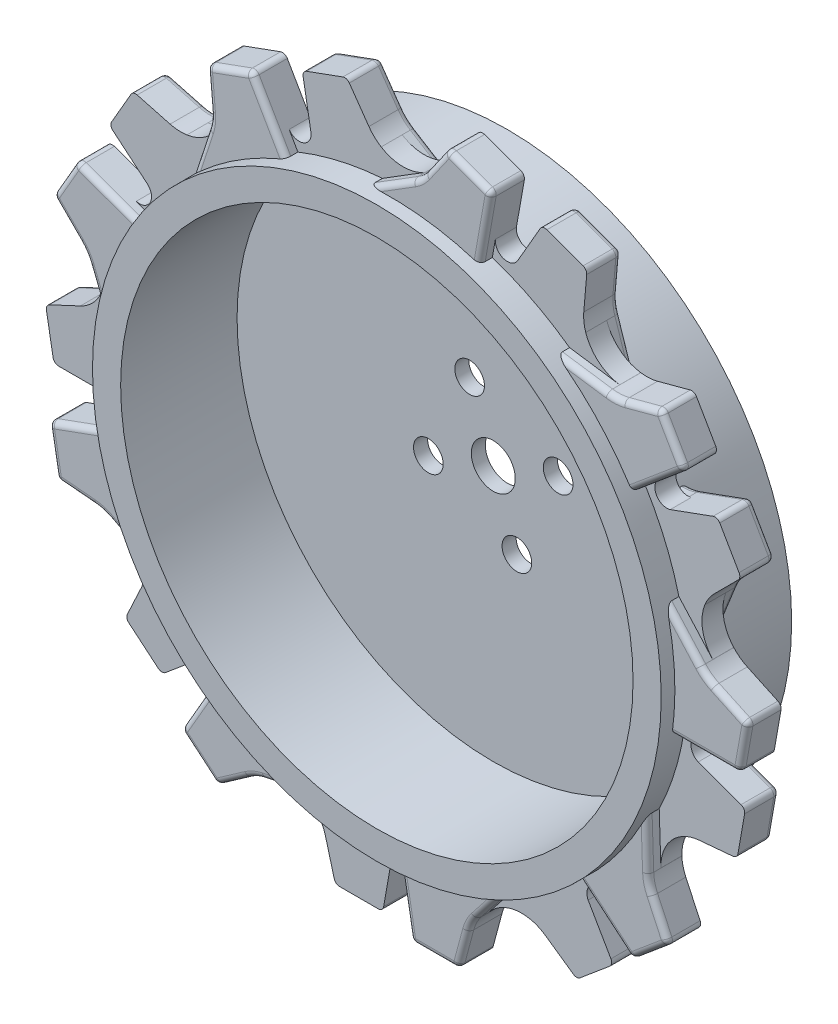
from build123d import *

# Parameters (mm, degrees)
BOSS_EXTRUDE3_DEPTH      = 3.9878
BOSS_EXTRUDE4_DEPTH      = 3.03
BOSS_EXTRUDE4_DEPTH_BACK = 11.96
SKETCH2_R                = 32.675
BOSS_EXTRUDE5_DEPTH      = 3.878
FILLET1_R                = 0.64
FILLET2_R                = 4.83
BOSS_EXTRUDE6_DEPTH      = 2.416
SKETCH5_R                = 29.439
CUT_EXTRUDE1_DEPTH       = 13.3772
SKETCH7_R                = 2.5265
SKETCH7_R_2              = 1.705
CUT_EXTRUDE2_DEPTH       = 1.6128


with BuildPart() as part:
    # Sketch1 → Boss-Extrude3 (new body)
    with BuildSketch(Plane.XY):
        with BuildLine():
            Line((2.40447012, 32.57804889), (-2.535542351, 35.644816652))
            ThreePointArc((-2.535542351, 35.644816652), (-3.305628506, 36.238022368), (-3.941337684, 36.973413113))
            Line((-3.941337684, 36.973413113), (-6.18856058, 40.174873341))
            ThreePointArc((-6.18856058, 40.174873341), (-6.520334289, 40.417679786), (-6.931364013, 40.408551267))
            Line((-6.931364013, 40.408551267), (-11.091948554, 38.893601767))
            ThreePointArc((-11.091948554, 38.893601767), (-11.427291277, 38.612125874), (-11.503227359, 38.180944785))
            Line((-11.503227359, 38.180944785), (-10.53546444, 32.7))
            ThreePointArc((-10.53546444, 32.7), (-10.462750974, 31.805424482), (-10.559003537, 30.913074747))
            ThreePointArc((-10.559003537, 30.913074747), (-14.992054318, 29.023250221), (-19.0988352, 26.501796921))
            Line((-19.0988352, 26.501796921), (-24.854384622, 25.675698515))
            ThreePointArc((-24.854384622, 25.675698515), (-25.825610126, 25.635118618), (-26.785291668, 25.789834629))
            Line((-26.785291668, 25.789834629), (-30.564623247, 26.797808414))
            ThreePointArc((-30.564623247, 26.797808414), (-30.974849628, 26.770548912), (-31.283848965, 26.499351247))
            Line((-31.283848965, 26.499351247), (-33.497250865, 22.664460409))
            ThreePointArc((-33.497250865, 22.664460409), (-33.573209078, 22.233283218), (-33.35422163, 21.854168568))
            Line((-33.35422163, 21.854168568), (-29.089788827, 18.277587286))
            ThreePointArc((-29.089788827, 18.277587286), (-28.459065022, 17.639041996), (-27.95920741, 16.893592486))
            ThreePointArc((-27.95920741, 16.893592486), (-30.140365536, 12.596392794), (-31.66558327, 8.025059638))
            Line((-31.66558327, 8.025059638), (-35.543584102, 3.692635689))
            ThreePointArc((-35.543584102, 3.692635689), (-36.261501748, 3.037257965), (-37.096109995, 2.538905901))
            Line((-37.096109995, 2.538905901), (-40.63915901, 0.881751105))
            ThreePointArc((-40.63915901, 0.881751105), (-40.935888579, 0.59718068), (-40.998273306, 0.190810271))
            Line((-40.998273306, 0.190810271), (-40.228817216, -4.169633862))
            ThreePointArc((-40.228817216, -4.169633862), (-40.009849227, -4.548759752), (-39.59840491, -4.698416004))
            Line((-39.59840491, -4.698416004), (-34.032677724, -4.697111652))
            ThreePointArc((-34.032677724, -4.697111652), (-33.139066258, -4.780844276), (-32.276987403, -5.030589452))
            ThreePointArc((-32.276987403, -5.030589452), (-31.185664747, -9.724456815), (-29.415653004, -14.206692238))
            Line((-29.415653004, -14.206692238), (-29.601545558, -20.018252415))
            ThreePointArc((-29.601545558, -20.018252415), (-29.7302337, -20.981769446), (-30.049246178, -21.900005116))
            Line((-30.049246178, -21.900005116), (-31.698180617, -25.446887345))
            ThreePointArc((-31.698180617, -25.446887345), (-31.742570312, -25.855615028), (-31.529149921, -26.207012952))
            Line((-31.529149921, -26.207012952), (-28.136872898, -29.052710109))
            ThreePointArc((-28.136872898, -29.052710109), (-27.725436263, -29.20238748), (-27.314054445, -29.052559511))
            Line((-27.314054445, -29.052559511), (-23.051298484, -25.473979846))
            ThreePointArc((-23.051298484, -25.473979846), (-22.312930093, -24.963720378), (-21.492006272, -24.600902676))
            ThreePointArc((-21.492006272, -24.600902676), (-17.638844833, -27.495125004), (-13.401811779, -29.790974926))
            Line((-13.401811779, -29.790974926), (-9.808614863, -34.362377736))
            ThreePointArc((-9.808614863, -34.362377736), (-9.28785889, -35.183193746), (-8.942006114, -36.091660347))
            Line((-8.942006114, -36.091660347), (-7.925271228, -39.868644396))
            ThreePointArc((-7.925271228, -39.868644396), (-7.696550617, -40.210281112), (-7.307186881, -40.342283556))
            Line((-7.307186881, -40.342283556), (-2.879373044, -40.341700411))
            ThreePointArc((-2.879373044, -40.341700411), (-2.467983537, -40.191893557), (-2.249154343, -39.812687539))
            Line((-2.249154343, -39.812687539), (-1.283960496, -34.331289757))
            ThreePointArc((-1.283960496, -34.331289757), (-1.046325956, -33.465794275), (-0.650676549, -32.660180129))
            ThreePointArc((-0.650676549, -32.660180129), (4.161386612, -32.40051863), (8.882886122, -31.435729357))
            Line((8.882886122, -31.435729357), (14.573875737, -32.627964619))
            ThreePointArc((14.573875737, -32.627964619), (15.500408318, -32.922010675), (16.34929799, -33.395626588))
            Line((16.34929799, -33.395626588), (19.555960648, -35.635419643))
            ThreePointArc((19.555960648, -35.635419643), (19.95077065, -35.750109776), (20.333890111, -35.600951329))
            Line((20.333890111, -35.600951329), (23.725417457, -32.754360742))
            ThreePointArc((23.725417457, -32.754360742), (23.944266114, -32.375165956), (23.868150072, -31.944016599))
            Line((23.868150072, -31.944016599), (21.084156878, -27.124607642))
            ThreePointArc((21.084156878, -27.124607642), (20.709865724, -26.308851099), (20.495111963, -25.437396323))
            ThreePointArc((20.495111963, -25.437396323), (24.014459013, -22.145349497), (27.011182884, -18.371356652))
            Line((27.011182884, -18.371356652), (32.13708791, -15.626564237))
            ThreePointArc((32.13708791, -15.626564237), (33.035862206, -15.256252922), (33.990583862, -15.073407997))
            Line((33.990583862, -15.073407997), (37.886741197, -14.727985996))
            ThreePointArc((37.886741197, -14.727985996), (38.262904601, -14.562064758), (38.460513934, -14.201538316))
            Line((38.460513934, -14.201538316), (39.228821452, -9.840891658))
            ThreePointArc((39.228821452, -9.840891658), (39.15272754, -9.409738395), (38.817281804, -9.128385274))
            Line((38.817281804, -9.128385274), (33.586762924, -7.226020154))
            ThreePointArc((33.586762924, -7.226020154), (32.775681067, -6.841704104), (32.051009809, -6.312172072))
            ThreePointArc((32.051009809, -6.312172072), (32.63089915, -1.528125216), (32.500646979, 3.289178006))
            Line((32.500646979, 3.289178006), (34.662999485, 8.686679221))
            ThreePointArc((34.662999485, 8.686679221), (35.113469015, 9.548075128), (35.727297782, 10.301825718))
            Line((35.727297782, 10.301825718), (38.489894475, 13.070835982))
            ThreePointArc((38.489894475, 13.070835982), (38.671400245, 13.4397322), (38.591035846, 13.842932309))
            Line((38.591035846, 13.842932309), (36.37662391, 17.677240002))
            ThreePointArc((36.37662391, 17.677240002), (36.041192615, 17.95861034), (35.603375973, 17.958518971))
            Line((35.603375973, 17.958518971), (30.373749323, 16.053702472))
            ThreePointArc((30.373749323, 16.053702472), (29.505390978, 15.826752279), (28.609883958, 15.766587644))
            ThreePointArc((28.609883958, 15.766587644), (25.978978923, 19.804125836), (22.782697148, 23.410669719))
            Line((22.782697148, 23.410669719), (20.969708365, 28.93532893))
            ThreePointArc((20.969708365, 28.93532893), (20.761093429, 29.88475271), (20.746812005, 30.856720687))
            Line((20.746812005, 30.856720687), (21.083198361, 34.753668538))
            ThreePointArc((21.083198361, 34.753668538), (20.985117929, 35.152929096), (20.664383195, 35.410141059))
            Line((20.664383195, 35.410141059), (16.503399759, 36.923994605))
            ThreePointArc((16.503399759, 36.923994605), (16.065583113, 36.923925708), (15.730254838, 36.642432603))
            Line((15.730254838, 36.642432603), (12.948520847, 31.821719294))
            ThreePointArc((12.948520847, 31.821719294), (12.429200534, 31.089695375), (11.78187544, 30.467985774))
            ThreePointArc((11.78187544, 30.467985774), (7.171205734, 31.869806312), (2.40447012, 32.57804889))
        make_face()
    extrude(amount=BOSS_EXTRUDE3_DEPTH)

    # Sketch2 → Boss-Extrude4 (add, two sides: drawn at the far end of the back side and taken through both)
    with BuildSketch(Plane.XY.offset(3.9878).offset(-BOSS_EXTRUDE4_DEPTH_BACK)):
        Circle(SKETCH2_R)
    extrude(amount=BOSS_EXTRUDE4_DEPTH + BOSS_EXTRUDE4_DEPTH_BACK)

    # Sketch3 → Boss-Extrude5 (add)
    with BuildSketch(Plane.XY.offset(1.5718)):
        with BuildLine():
            Line((10.239668503, 31.020314876), (11.503289007, 38.18098864))
            ThreePointArc((11.503289007, 38.18098864), (11.427326117, 38.612134827), (11.091999205, 38.893583324))
            Line((11.091999205, 38.893583324), (6.931855468, 40.408372319))
            ThreePointArc((6.931855468, 40.408372319), (6.520511624, 40.41740193), (6.188673902, 40.174155104))
            Line((6.188673902, 40.174155104), (3.961411749, 36.994177094))
            ThreePointArc((3.961411749, 36.994177094), (3.326186617, 36.257873884), (2.556345726, 35.663737208))
            Line((2.556345726, 35.663737208), (-2.40447012, 32.57804889))
            ThreePointArc((-2.40447012, 32.57804889), (-7.335432281, 31.832407689), (-12.095432895, 30.344871875))
            Line((-12.095432895, 30.344871875), (-15.730235802, 36.642505825))
            ThreePointArc((-15.730235802, 36.642505825), (-16.065562179, 36.923954961), (-16.503349103, 36.924013034))
            Line((-16.503349103, 36.924013034), (-20.663891693, 35.410319877))
            ThreePointArc((-20.663891693, 35.410319877), (-20.984803481, 35.152830234), (-21.082649878, 34.753191179))
            Line((-21.082649878, 34.753191179), (-20.744781209, 30.88553018))
            ThreePointArc((-20.744781209, 30.88553018), (-20.758105311, 29.913174353), (-20.965933954, 28.963195068))
            Line((-20.965933954, 28.963195068), (-22.782697148, 23.410669719))
            ThreePointArc((-22.782697148, 23.410669719), (-26.080744386, 19.669914039), (-28.770946815, 15.470726078))
            Line((-28.770946815, 15.470726078), (-35.603408458, 17.958587298))
            ThreePointArc((-35.603408458, 17.958587298), (-36.041195382, 17.958646205), (-36.376596952, 17.677286681))
            Line((-36.376596952, 17.677286681), (-38.590774277, 13.843385223))
            ThreePointArc((-38.590774277, 13.843385223), (-38.671095816, 13.439858592), (-38.489167472, 13.070822863))
            Line((-38.489167472, 13.070822863), (-35.744260487, 10.32520044))
            ThreePointArc((-35.744260487, 10.32520044), (-35.129449064, 9.571768094), (-34.678020127, 8.710452066))
            Line((-34.678020127, 8.710452066), (-32.500646979, 3.289178006))
            ThreePointArc((-32.500646979, 3.289178006), (-32.622586337, -1.696350996), (-31.984214967, -6.642344388))
            Line((-31.984214967, -6.642344388), (-38.817350608, -9.128353813))
            ThreePointArc((-38.817350608, -9.128353813), (-39.152752713, -9.409712699), (-39.228830806, -9.840838572))
            Line((-39.228830806, -9.840838572), (-38.460604688, -14.201023229))
            ThreePointArc((-38.460604688, -14.201023229), (-38.262752638, -14.561772253), (-37.886175847, -14.727528737))
            Line((-37.886175847, -14.727528737), (-34.01860303, -15.066405337))
            ThreePointArc((-34.01860303, -15.066405337), (-33.063333179, -15.248374834), (-32.163875279, -15.618008264))
            Line((-32.163875279, -15.618008264), (-27.011182884, -18.371356652))
            ThreePointArc((-27.011182884, -18.371356652), (-23.899957582, -22.268874548), (-20.231713471, -25.647388094))
            Line((-20.231713471, -25.647388094), (-23.868223002, -31.944036725))
            ThreePointArc((-23.868223002, -31.944036725), (-23.944301915, -32.375162453), (-23.725458746, -32.754326088))
            Line((-23.725458746, -32.754326088), (-20.334290724, -35.600615086))
            ThreePointArc((-20.334290724, -35.600615086), (-19.950842258, -35.749788025), (-19.555821485, -35.634705963))
            Line((-19.555821485, -35.634705963), (-16.375263141, -33.408272613))
            ThreePointArc((-16.375263141, -33.408272613), (-15.526516242, -32.93363371), (-14.599895727, -32.638628952))
            Line((-14.599895727, -32.638628952), (-8.882886122, -31.435729357))
            ThreePointArc((-8.882886122, -31.435729357), (-3.994273055, -32.421544207), (0.987431609, -32.651733872))
            Line((0.987431609, -32.651733872), (2.249111413, -39.812749835))
            ThreePointArc((2.249111413, -39.812749835), (2.46795386, -40.191913886), (2.87931914, -40.341700404))
            Line((2.87931914, -40.341700404), (7.306663861, -40.342283487))
            ThreePointArc((7.306663861, -40.342283487), (7.696288944, -40.210080665), (7.924919088, -39.868008233))
            Line((7.924919088, -39.868008233), (8.930244363, -36.118037841))
            ThreePointArc((8.930244363, -36.118037841), (9.275330203, -35.208879357), (9.795537296, -34.387272415))
            Line((9.795537296, -34.387272415), (13.401811779, -29.790974926))
            ThreePointArc((13.401811779, -29.790974926), (17.780376225, -27.403813007), (21.744546465, -24.377970488))
            Line((21.744546465, -24.377970488), (27.314061601, -29.052634827))
            ThreePointArc((27.314061601, -29.052634827), (27.725426596, -29.202422128), (28.136831601, -29.052744753))
            Line((28.136831601, -29.052744753), (31.52874922, -26.20734909))
            ThreePointArc((31.52874922, -26.20734909), (31.742241015, -25.855629677), (31.697501945, -25.446626367))
            Line((31.697501945, -25.446626367), (30.057191281, -21.927771757))
            ThreePointArc((30.057191281, -21.927771757), (29.737146562, -21.00949905), (29.607529553, -20.045728944))
            Line((29.607529553, -20.045728944), (29.415653004, -14.206692238))
            ThreePointArc((29.415653004, -14.206692238), (31.235389863, -9.563533141), (32.327146366, -4.697483781))
            Line((32.327146366, -4.697483781), (39.598458804, -4.6984691))
            ThreePointArc((39.598458804, -4.6984691), (40.009864094, -4.548792508), (40.228807849, -4.169686946))
            Line((40.228807849, -4.169686946), (40.998182416, 0.190295208))
            ThreePointArc((40.998182416, 0.190295208), (40.935645738, 0.59695779), (40.638471363, 0.881514783))
            Line((40.638471363, 0.881514783), (37.12004435, 2.522742433))
            ThreePointArc((37.12004435, 2.522742433), (36.284621553, 3.020459358), (35.56582968, 3.675433884))
            Line((35.56582968, 3.675433884), (31.66558327, 8.025059638))
            ThreePointArc((31.66558327, 8.025059638), (30.075017441, 12.751630168), (27.783515207, 17.181007794))
            Line((27.783515207, 17.181007794), (33.354297045, 21.854162537))
            ThreePointArc((33.354297045, 21.854162537), (33.573241522, 22.233267681), (33.497277811, 22.664413723))
            Line((33.497277811, 22.664413723), (31.284110416, 26.498898264))
            ThreePointArc((31.284110416, 26.498898264), (30.974806872, 26.770222073), (30.564248384, 26.79718537))
            Line((30.564248384, 26.79718537), (26.814016124, 25.792837401))
            ThreePointArc((26.814016124, 25.792837401), (25.854118861, 25.637111263), (24.882482831, 25.67682035))
            Line((24.882482831, 25.67682035), (19.0988352, 26.501796921))
            ThreePointArc((19.0988352, 26.501796921), (14.842210112, 29.100164003), (10.239668503, 31.020314876))
        make_face()
    extrude(amount=BOSS_EXTRUDE5_DEPTH)

    # Fillet1
    fillet1_edges = [part.edges().sort_by_distance(p)[0] for p in [
        (0.0835606, 34.125634522, 5.4498),
        (3.326186617, 36.257873884, 5.4498),
        (5.075042826, 38.584166099, 5.4498),
        (6.520511624, 40.41740193, 5.4498),
        (9.011927336, 39.650977822, 5.4498),
        (11.427326117, 38.612134827, 5.4498),
        (10.872210924, 34.604800808, 5.4498),
        (21.873398998, 26.181543124, 0),
        (20.761093429, 29.88475271, 0),
        (20.915005183, 32.805194613, 0),
        (20.985117929, 35.152929096, 0),
        (12.432352999, 31.093357133, 0),
        (14.339387842, 34.232075949, 0),
        (16.065583113, 36.923925708, 0),
        (30.572133957, 19.520292892, 5.4498),
        (33.573241522, 22.233267681, 5.4498),
        (21.999546176, 26.088040975, 5.4498),
        (25.854118861, 25.637111263, 5.4498),
        (28.689132254, 26.295011385, 5.4498),
        (30.974806872, 26.770222073, 5.4498),
        (33.585167277, 5.996275765, 0),
        (35.113469015, 9.548075128, 0),
        (37.108596129, 11.68633085, 0),
        (38.671400245, 13.4397322, 0),
        (29.510159639, 15.827530983, 0),
        (32.988562648, 17.006110722, 0),
        (36.041192615, 17.95861034, 0),
        (35.967015741, -4.697977011, 5.4498),
        (40.009864094, -4.548792508, 5.4498),
        (33.621699599, 5.84356312, 5.4498),
        (36.284621553, 3.020459358, 5.4498),
        (38.879257856, 1.702128608, 5.4498),
        (40.935645738, 0.59695779, 5.4498),
        (29.58206253, -16.994715666, 0),
        (35.93866253, -14.900696996, 0),
        (38.262904601, -14.562064758, 0),
        (32.779834615, -6.844172818, 0),
        (36.202022364, -8.177202714, 0),
        (39.15272754, -9.409738395, 0),
        (24.53253113, -26.718011259, 5.4498),
        (29.511886116, -17.135182863, 5.4498),
        (29.737146562, -21.00949905, 5.4498),
        (30.877346613, -23.687199062, 5.4498),
        (31.742241015, -25.855629677, 5.4498),
        (20.711460667, -26.313412093, 0),
        (22.476153475, -29.53431212, 0),
        (23.944266114, -32.375165956, 0),
        (22.029653784, -34.177656036, 0),
        (19.95077065, -35.750109776, 0),
        (17.952629319, -34.515523115, 0),
        (15.500408318, -32.922010675, 0),
        (-11.599656498, -32.083745935, 0),
        (-9.28785889, -35.183193746, 0),
        (-8.433638671, -37.980152371, 0),
        (-7.696550617, -40.210281112, 0),
        (-1.048035909, -33.470313409, 0),
        (-1.76655742, -37.071988648, 0),
        (-2.467983537, -40.191893557, 0),
        (1.619002555, -36.236391101, 5.4498),
        (2.46795386, -40.191913886, 5.4498),
        (11.593133131, -32.096186348, 5.4498),
        (9.275330203, -35.208879357, 5.4498),
        (8.427581726, -37.993023037, 5.4498),
        (7.696288944, -40.210080665, 5.4498),
        (-22.052075309, -28.799360824, 5.4498),
        (-23.944301915, -32.375162453, 5.4498),
        (-11.750175689, -32.039027531, 5.4498),
        (-15.526516242, -32.93363371, 5.4498),
        (-17.965542313, -34.521489288, 5.4498),
        (-19.950842258, -35.749788025, 5.4498),
        (-22.317144836, -24.966083099, 0),
        (-25.182676464, -27.263269678, 0),
        (-27.725436263, -29.20238748, 0),
        (-29.83301141, -27.62986153, 0),
        (-31.742570312, -25.855615028, 0),
        (-30.873713398, -23.673446231, 0),
        (-29.7302337, -20.981769446, 0),
        (-35.404742054, -7.886789549, 5.4498),
        (-39.152752713, -9.409712699, 5.4498),
        (-29.595446716, -16.990451659, 5.4498),
        (-33.063333179, -15.248374834, 5.4498),
        (-35.952389438, -14.896967037, 5.4498),
        (-38.262752638, -14.561772253, 5.4498),
        (-33.610580955, 5.852147637, 0),
        (-36.261501748, 3.037257965, 0),
        (-38.867634502, 1.710328503, 0),
        (-40.935888579, 0.59718068, 0),
        (-33.143813666, -4.77994504, 0),
        (-36.815541317, -4.697763828, 0),
        (-40.009849227, -4.548759752, 0),
        (-32.191136513, 16.716098209, 5.4498),
        (-36.041195382, 17.958646205, 5.4498),
        (-33.592679308, 6.008145373, 5.4498),
        (-35.129449064, 9.571768094, 5.4498),
        (-37.11671398, 11.698011652, 5.4498),
        (-38.671095816, 13.439858592, 5.4498),
        (-28.46212373, 17.642782426, 0),
        (-31.222005228, 20.065877927, 0),
        (-33.573209078, 22.233283218, 0),
        (-32.390549915, 24.581905828, 0),
        (-30.974849628, 26.770548912, 0),
        (-28.674957458, 26.293821521, 0),
        (-25.825610126, 25.635118618, 0),
        (-21.87152391, 26.195464412, 5.4498),
        (-20.758105311, 29.913174353, 5.4498),
        (-20.913715543, 32.81936068, 5.4498),
        (-20.984803481, 35.152830234, 5.4498),
        (-18.583620398, 36.167166456, 5.4498),
        (-16.065562179, 36.923954961, 5.4498),
        (-10.462689779, 31.810255917, 0),
        (-11.019345899, 35.440472392, 0),
        (-11.427291277, 38.612125874, 0),
        (-9.011656283, 39.651076517, 0),
        (-6.520334289, 40.417679786, 0),
        (-5.064949132, 38.574143227, 0),
        (-3.305628506, 36.238022368, 0),
        (18.583891477, 36.167067832, 0),
        (32.390694114, 24.581655993, 5.4498),
        (37.483829878, 15.760086155, 0),
        (40.613495133, -1.989695869, 5.4498),
        (38.844667693, -12.021214987, 0),
        (29.83279041, -27.630046921, 5.4498),
        (11.737181957, -32.033690761, 0),
        (-5.093279963, -40.341991983, 0),
        (5.0929915, -40.341991945, 5.4498),
        (-22.029874735, -34.177470587, 5.4498),
        (-29.508886761, -17.121459814, 0),
        (-40.613545261, -1.989411796, 0),
        (-37.483685614, 15.760335952, 5.4498),
        (-21.985510779, 26.08747017, 0),
        (-13.914940432, 33.497337836, 5.4498),
        (-0.073175768, 34.11617548, 0),
    ]]
    fillet(fillet1_edges, radius=FILLET1_R)

    # Fillet2
    # the kernel refuses this fillet: 4.83 mm, written as the material it adds along each edge
    with BuildSketch(Plane(origin=(-29.506221297, -17.038129386, 1.5718), x_dir=(-0.03197033553912636, -0.9994888181693259, 0), z_dir=(0, 0, 1)), Plane(origin=(-11.6511784, -32.018197796, 1.5718), x_dir=(0.6179683304550898, -0.7862029906802371, 0), z_dir=(0, 0, 1)), Plane(origin=(11.655580358, -32.016595614, 1.5718), x_dir=(0.9787527466763924, -0.20504404617890606, 0), z_dir=(0, 0, 1)), Plane(origin=(29.50856353, -17.03407252, 1.5718), x_dir=(0.8815678751026841, 0.4720572863402687, 0), z_dir=(0, 0, 1)), Plane(origin=(33.554161875, 5.918882419, 1.5718), x_dir=(0.3718875972328407, 0.9282777682484831, 0), z_dir=(0, 0, 1)), Plane(origin=(21.899394965, 26.102326493, 1.5718), x_dir=(-0.31180302045251085, 0.9501467657350053, 0), z_dir=(0, 0, 1)), Plane(origin=(-0.002342233, 34.072201906, 1.5718), x_dir=(-0.8495975395635607, 0.5274315318290557, 0), z_dir=(0, 0, 1)), Plane(origin=(-21.902983474, 26.099315377, 1.5718), x_dir=(-0.9898559276879302, -0.14207477756824763, 0), z_dir=(0, 0, 1)), Plane(origin=(-33.554975324, 5.914269121, 1.5718), x_dir=(-0.6669497262238803, -0.7451027195560966, 0), z_dir=(0, 0, 1))) as fillet2_piece_1:
        with BuildLine():
            CenterArc((FILLET2_R * 0.621406781647, -FILLET2_R), FILLET2_R, 90, 63.714196457)
            Line((-FILLET2_R * 0.275189403146, -FILLET2_R * 0.557150949629), (0, 0))
            Line((0, 0), (FILLET2_R * 0.621406781647, 0))
        make_face()
    extrude(amount=2.416)

    # Sketch4 → Boss-Extrude6 (add)
    with BuildSketch(Plane.XY.offset(3.9878)):
        with BuildLine():
            Line((29.335703303, 18.483089867), (26.831124565, 16.905068934))
            ThreePointArc((26.831124565, 16.905068934), (27.464331686, 15.85563263), (28.056513485, 14.782511699))
            Line((28.056513485, 14.782511699), (30.682869079, 16.166294909))
            ThreePointArc((30.682869079, 16.166294909), (29.101457116, 16.796809567), (29.335703303, 18.483089867))
        make_face()
        with BuildLine():
            Line((10.591751345, 33.015494889), (9.687465024, 30.196748542))
            ThreePointArc((9.687465024, 30.196748542), (10.847094474, 29.799851385), (11.990520888, 29.358440182))
            Line((11.990520888, 29.358440182), (13.112947294, 32.106668454))
            ThreePointArc((13.112947294, 32.106668454), (11.496228439, 31.573158689), (10.591751345, 33.015494889))
        make_face()
        with BuildLine():
            Line((34.353153656, -4.697758321), (31.420202727, -4.296680307))
            ThreePointArc((31.420202727, -4.296680307), (31.230702871, -5.507612848), (30.994551609, -6.710318297))
            Line((30.994551609, -6.710318297), (33.895935419, -7.338467692))
            ThreePointArc((33.895935419, -7.338467692), (33.089790582, -5.838953427), (34.353153656, -4.697758321))
        make_face()
        with BuildLine():
            Line((23.29638162, -25.68047318), (21.307418837, -23.48796508))
            ThreePointArc((21.307418837, -23.48796508), (20.383881091, -24.293785064), (19.429894569, -25.063315785))
            Line((19.429894569, -25.063315785), (21.248716865, -27.409479703))
            ThreePointArc((21.248716865, -27.409479703), (21.595043283, -25.74260522), (23.29638162, -25.68047318))
        make_face()
        with BuildLine():
            Line((1.338973714, -34.647009232), (1.224656867, -31.688969952))
            ThreePointArc((1.224656867, -31.688969952), (-0.000785192, -31.712625253), (-1.226226079, -31.688909269))
            Line((-1.226226079, -31.688909269), (-1.341012463, -34.655291538))
            ThreePointArc((-1.341012463, -34.655291538), (-0.004264771, -33.601005933), (1.338973714, -34.647009232))
        make_face()
        with BuildLine():
            Line((-21.244954874, -27.401824606), (-19.431135661, -25.0623536))
            ThreePointArc((-19.431135661, -25.0623536), (-20.385084076, -24.29277564), (-21.308581917, -23.486909924))
            Line((-21.308581917, -23.486909924), (-23.303267156, -25.685507312))
            ThreePointArc((-23.303267156, -25.685507312), (-21.601577291, -25.737122536), (-21.244954874, -27.401824606))
        make_face()
        with BuildLine():
            Line((-33.888132965, -7.335021709), (-30.994883861, -6.708783462))
            ThreePointArc((-30.994883861, -6.708783462), (-31.230975565, -5.506066321), (-31.420415457, -4.295124397))
            Line((-31.420415457, -4.295124397), (-34.36166416, -4.697188752))
            ThreePointArc((-34.36166416, -4.697188752), (-33.091271722, -5.830553469), (-33.888132965, -7.335021709))
        make_face()
        with BuildLine():
            Line((-30.674677017, 16.163919365), (-28.055781432, 14.783901018))
            ThreePointArc((-28.055781432, 14.783901018), (-27.463546494, 15.856992623), (-26.830287406, 16.90639757))
            Line((-26.830287406, 16.90639757), (-29.341856616, 18.488996628))
            ThreePointArc((-29.341856616, 18.488996628), (-29.097192345, 16.804196366), (-30.674677017, 16.163919365))
        make_face()
        with BuildLine():
            Line((-13.108198782, 32.099582926), (-11.989067066, 29.359033907))
            ThreePointArc((-11.989067066, 29.359033907), (-10.845618795, 29.800388488), (-9.685969692, 30.19722822))
            Line((-9.685969692, 30.19722822), (-10.592668263, 33.023975004))
            ThreePointArc((-10.592668263, 33.023975004), (-11.488213291, 31.576075964), (-13.108198782, 32.099582926))
        make_face()
    extrude(amount=-BOSS_EXTRUDE6_DEPTH)

    # Sketch5 → Cut-Extrude1 (cut)
    with BuildSketch(Plane.XY.offset(7.0178)):
        Circle(SKETCH5_R)
    extrude(amount=-CUT_EXTRUDE1_DEPTH, mode=Mode.SUBTRACT)

    # Sketch7 → Cut-Extrude2 (cut)
    with BuildSketch(Plane(origin=(0, 0, -7.9722), x_dir=(-1, 0, 0), z_dir=(0, 0, -1))):
        Circle(SKETCH7_R)
        with Locations((2.713929837, 7.456460946)):
            Circle(SKETCH7_R_2)
        with Locations(Location((-2.713929837, -7.456460946, 0), (0, 0, 180))):
            Circle(SKETCH7_R_2)
        with Locations((-7.456460946, 2.713929837)):
            Circle(SKETCH7_R_2)
        with Locations(Location((7.456460946, -2.713929837, 0), (0, 0, 180))):
            Circle(SKETCH7_R_2)
    extrude(amount=-CUT_EXTRUDE2_DEPTH, mode=Mode.SUBTRACT)


solid = part.part
